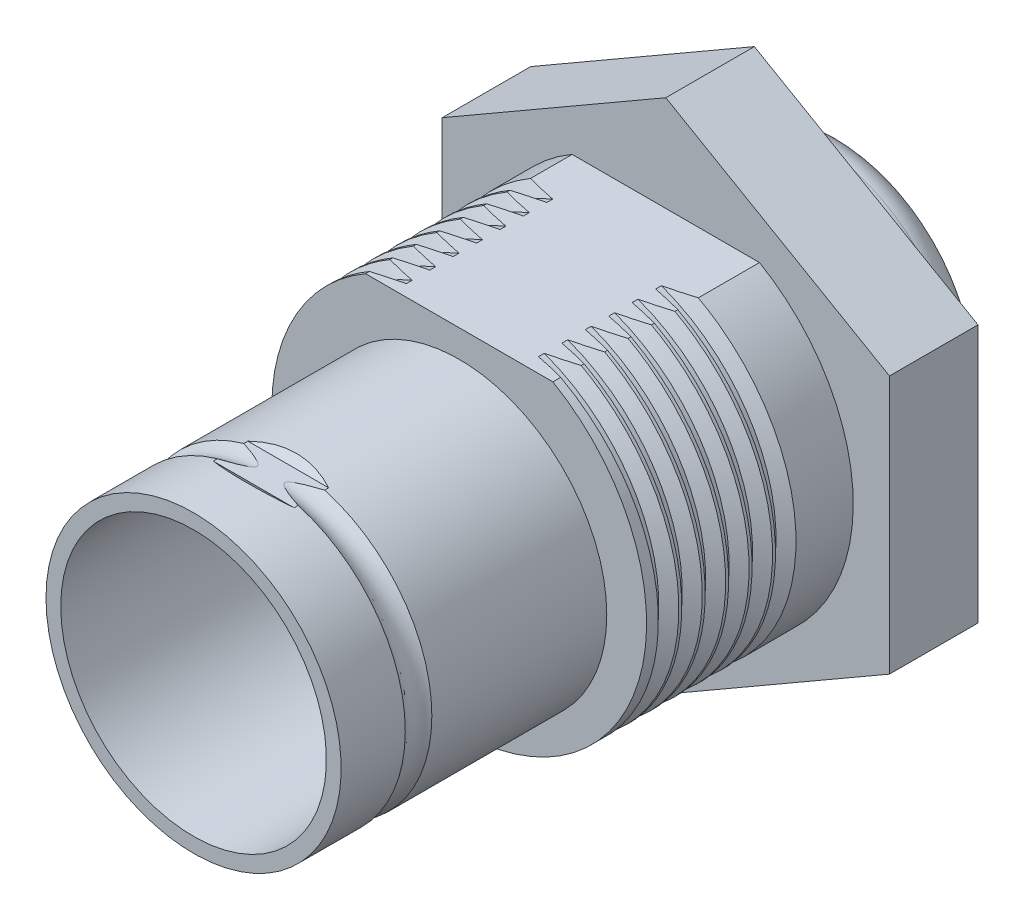
from build123d import *

# Parameters (mm, degrees)
BOSS_EXTRUDE1_DEPTH     = 3
BOSS_EXTRUDE2_DEPTH     = 7
SKETCH3_W               = 9
SKETCH3_H               = 0.5
SKETCH5_R               = 0.687364707
CUT_EXTRUDE1_DEPTH      = 23.248244313
CUT_EXTRUDE1_DEPTH_BACK = 23.248244313
THREAD1_PITCH           = 0.79375
SKETCH14_R              = 5
BOSS_EXTRUDE3_DEPTH     = 3
FILLET1_R               = 1


with BuildPart() as part:
    # Sketch1 → Boss-Extrude1 (new body)
    with BuildSketch(Plane.XY):
        Polygon((0, -8.75), (7.577722283, -4.375), (7.577722283, 4.375), (0, 8.75), (-7.577722283, 4.375), (-7.577722283, -4.375), align=None)
    extrude(amount=BOSS_EXTRUDE1_DEPTH)

    # Sketch2 → Boss-Extrude2 (add)
    with BuildSketch(Plane.XY.offset(3)):
        with BuildLine():
            Line((-3.173720215, 5.5), (3.173720215, 5.5))
            ThreePointArc((3.173720215, 5.5), (0, -6.35), (-3.173720215, 5.5))
        make_face()
    extrude(amount=BOSS_EXTRUDE2_DEPTH)

    # Sketch3 → Revolve3 (revolve)
    with BuildSketch(Plane(origin=(0, 0, 0), x_dir=(0, 0, -1), z_dir=(1, 0, 0)), mode=Mode.PRIVATE) as revolve3_sk:
        with Locations((-14.5, 4.325)):
            Rectangle(SKETCH3_W, SKETCH3_H)
    revolve(revolve3_sk.sketch.rotate(Axis((0, -0.425, 10), (0, 0, 1)), 90), axis=Axis((0, -0.425, 10), (0, 0, 1)))

    # Sketch5 → Cut-Revolve1 (revolve, cut)
    with BuildSketch(Plane(origin=(0, 0, 0), x_dir=(0, 0, -1), z_dir=(1, 0, 0)), mode=Mode.PRIVATE) as cut_revolve1_sk:
        with Locations((-16.376840098, 5.094455998)):
            Circle(SKETCH5_R)
    revolve(cut_revolve1_sk.sketch.rotate(Axis((0, -0.425, 3), (0, 0, 1)), 90), axis=Axis((0, -0.425, 3), (0, 0, 1)), mode=Mode.SUBTRACT)

    # Sketch6 → Cut-Extrude1 (cut, two sides: drawn at the far end of the back side and taken through both)
    with BuildSketch(Plane(origin=(0, 0, 0), x_dir=(0, 0, -1), z_dir=(1, 0, 0)).offset(-CUT_EXTRUDE1_DEPTH_BACK)):
        Polygon((-17.220807432, 4.575), (-16.963720636, 4.383895949), (-15.792004544, 4.383895949), (-15.516050553, 4.575), (-15.516050553, 5.175920865), (-17.220807432, 5.175920865), align=None)
        Polygon((-17.220807432, -6.025920865), (-17.220807432, -5.425), (-16.963720636, -5.233895949), (-15.792004544, -5.233895949), (-15.516050553, -5.425), (-15.516050553, -6.025920865), align=None)
    extrude(amount=CUT_EXTRUDE1_DEPTH + CUT_EXTRUDE1_DEPTH_BACK, mode=Mode.SUBTRACT)

    # Thread1: the profile of Thread Profile1 profile screwed along a right-hand helix of 6.299213 turns, 8 arcs to a turn; built about Z, then put on its axis
    thread1_z = Axis((0, 0, 0), (0, 0, 1))
    thread1_corners = [(6.3503, 0, -0.000173205), (6.3503, 0, 0.694704453), (5.920370212, 0, 0.446484374), (5.920370212, 0, 0.248046874)]
    with BuildLine(mode=Mode.PRIVATE) as thread1_profile:
        Line(thread1_corners[0], thread1_corners[1])
        Line(thread1_corners[1], thread1_corners[2])
        Line(thread1_corners[2], thread1_corners[3])
        Line(thread1_corners[3], thread1_corners[0])
    thread1_cap = Face(thread1_profile.wire())
    thread1_turn_angles = [0, 22.5, 45, 67.5, 90, 112.5, 135, 157.5, 180, 202.5, 225, 247.5, 270, 292.5, 315, 337.5, 360]
    thread1_turn_weights = [1, 0.9238795325112867, 1, 0.9238795325112867, 1, 0.9238795325112867, 1, 0.9238795325112867, 1, 0.9238795325112867, 1, 0.9238795325112867, 1, 0.9238795325112867, 1, 0.9238795325112867, 1]
    thread1_turn_rails = [Edge.make_bspline([Vector(p[0], p[1], 0).rotate(thread1_z, thread1_turn_angles[k]) / thread1_turn_weights[k] + Vector(0, 0, p[2] + THREAD1_PITCH * thread1_turn_angles[k] / 360) for k in range(17)], [0, 0, 0, 1, 1, 2, 2, 3, 3, 4, 4, 5, 5, 6, 6, 7, 7, 8, 8, 8], 2, thread1_turn_weights) for p in thread1_corners]
    thread1_turn_sides = [Face.make_surface_from_curves(thread1_turn_rails[p[0]], thread1_turn_rails[p[1]]) for p in [(0, 1), (1, 2), (2, 3), (3, 0)]]
    thread1_last_angles = [2160, 2182.5, 2205, 2227.5, 2250, 2258.858267717, 2267.716535433]
    thread1_last_weights = [1, 0.9238795325112867, 1, 0.9238795325112867, 1, 0.988072289441528, 1]
    thread1_last_rails = [Edge.make_bspline([Vector(p[0], p[1], 0).rotate(thread1_z, thread1_last_angles[k]) / thread1_last_weights[k] + Vector(0, 0, p[2] + THREAD1_PITCH * thread1_last_angles[k] / 360) for k in range(7)], [0, 0, 0, 1, 1, 2, 2, 3, 3, 3], 2, thread1_last_weights) for p in thread1_corners]
    thread1_last_sides = [Face.make_surface_from_curves(thread1_last_rails[p[0]], thread1_last_rails[p[1]]) for p in [(0, 1), (1, 2), (2, 3), (3, 0)]]
    thread1 = Plane(origin=(0, 0, 10), x_dir=(-1, 0, 0), z_dir=(0, 0, -1)) * Solid(Shell([*[p.moved(Location((0, 0, THREAD1_PITCH * i))) for i in range(6) for p in thread1_turn_sides], *thread1_last_sides, thread1_cap, thread1_cap.rotate(thread1_z, 2267.716535433).moved(Location((0, 0, THREAD1_PITCH * 2267.716535433 / 360)))]))
    add(thread1, mode=Mode.SUBTRACT)

    # Sketch14 → Boss-Extrude3 (add)
    with BuildSketch(Plane(origin=(0, 0, 0), x_dir=(-1, 0, 0), z_dir=(0, 0, -1))):
        with Locations(Location((0, 0, 0), (0, 0, 180))):
            Circle(SKETCH14_R)
    extrude(amount=BOSS_EXTRUDE3_DEPTH)

    # Fillet1
    fillet1_edges = [part.edges().sort_by_distance(p)[0] for p in [
        (-5, 0, -3),
    ]]
    fillet(fillet1_edges, radius=FILLET1_R)


solid = part.part
